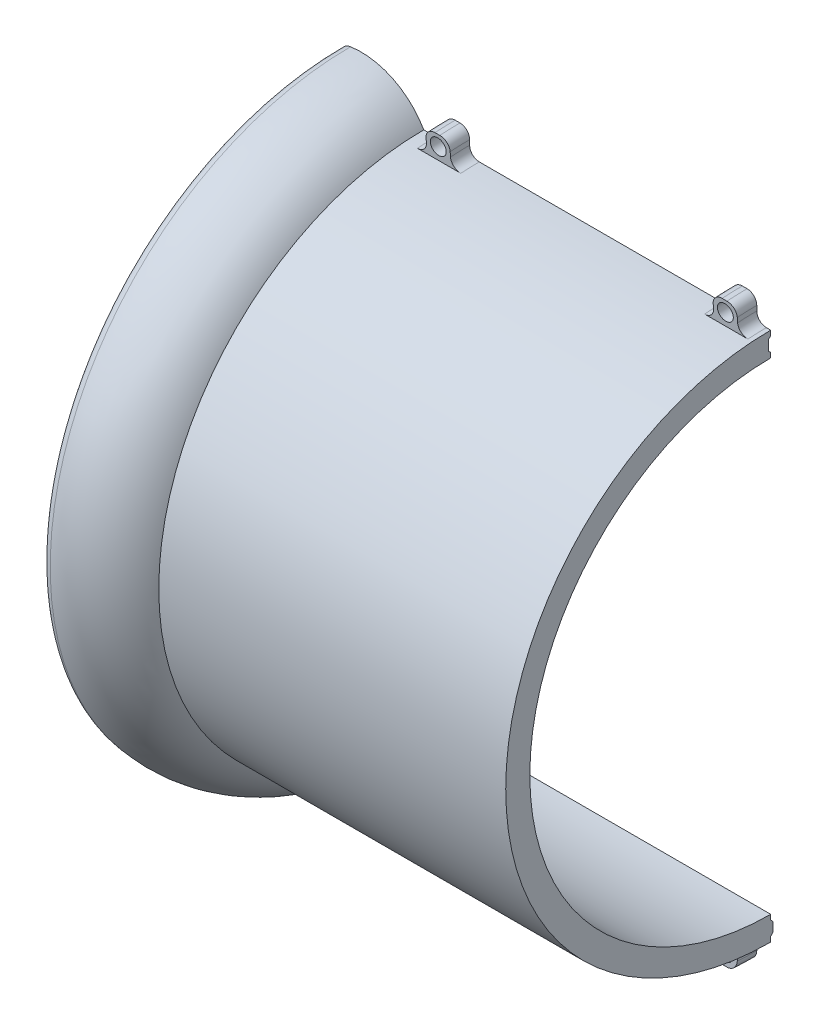
from build123d import *

# Parameters (mm, degrees)
REVOLVE1_ANGLE                 = 180
FILLET1_R                      = 2.5
FILLET2_R                      = 2.5
CUT_EXTRUDE1_DEPTH             = 70
BOSS_EXTRUDE1_DEPTH            = 70
SKETCH7_W                      = 5
SKETCH7_H                      = 5
REVOLVE2_ANGLE                 = 4
F_3_0MM_DOWEL_HOLE2_AT_2_COUNT = 2
F_3_0MM_DOWEL_HOLE2_AT_2_PITCH = 59.592915104
FILLET3_R                      = 2
FILLET3_OF_MIRROR3_R           = 2


with BuildPart() as part:
    # Sketch1 → Revolve1 (revolve)
    with BuildSketch(Plane.XY):
        with BuildLine():
            Line((4.330127019, 50), (0, 47.5))
            ThreePointArc((0, 47.5), (-4.264235636, 55.691520443), (-13.420201433, 56.896926208))
            Line((-13.420201433, 56.896926208), (-15.13030215, 61.595389312))
            ThreePointArc((-15.13030215, 61.595389312), (-4.86969785, 61.595389312), (2.990381057, 55))
            Line((2.990381057, 55), (75, 55))
            Line((75, 55), (75, 50))
            Line((75, 50), (4.330127019, 50))
        make_face()
    revolve(axis=Axis((-156.553254438, 0, 0), (1, 0, 0)), revolution_arc=REVOLVE1_ANGLE)

    # Fillet1
    fillet1_edges = [part.edges().sort_by_distance(p)[0] for p in [
        (4.330127019, 0, 50),
    ]]
    fillet(fillet1_edges, radius=FILLET1_R)

    # Fillet2
    fillet2_edges = [part.edges().sort_by_distance(p)[0] for p in [
        (-15.13030215, 0, 61.595389312),
        (-13.420201433, 0, 56.896926208),
    ]]
    fillet(fillet2_edges, radius=FILLET2_R - 0.0001)  # a hair under: the kernel refuses the full size

    # Sketch3 → Cut-Extrude1 (cut)
    with BuildSketch(Plane(origin=(75, 0, 0), x_dir=(0, 0, -1), z_dir=(1, 0, 0))):
        Polygon((0, 54), (0, 51), (-0.5, 51.5), (-0.5, 53.5), align=None)
    extrude(amount=-CUT_EXTRUDE1_DEPTH, mode=Mode.SUBTRACT)

    # Sketch5 → Boss-Extrude1 (add)
    with BuildSketch(Plane(origin=(75, 0, 0), x_dir=(0, 0, -1), z_dir=(1, 0, 0))):
        Polygon((0, -51.05), (0, -53.95), (0.5, -53.45), (0.5, -51.55), align=None)
    extrude(amount=-BOSS_EXTRUDE1_DEPTH)

    # Sketch7 → Revolve2 (revolve)
    with BuildSketch(Plane(origin=(0, 0, 0), x_dir=(-1, 0, 0), z_dir=(0, 0, -1))):
        with Locations((-69.608609025, 57.5)):
            Rectangle(SKETCH7_W, SKETCH7_H)
        with Locations((-10.015693921, 57.5)):
            Rectangle(SKETCH7_W, SKETCH7_H)
    revolve2 = revolve(axis=Axis((75, 0, 0), (1, 0, 0)), revolution_arc=REVOLVE2_ANGLE)

    # Sketch11 → Ø3.0mm Dowel Hole2 (revolve, cut)
    with BuildSketch(Plane(origin=(69.608609025, 57.5, 0), x_dir=(0, 1, 0), z_dir=(1, 0, 0))):
        Polygon((0, 0), (0, 45.991420021), (1.65, 45), (1.65, 0), align=None)
    f_3_0mm_dowel_hole2 = revolve(axis=Axis((69.608609025, 57.5, -6.35), (0, 0, 1)), mode=Mode.SUBTRACT)

    # Ø3.0mm Dowel Hole2 at 2: Ø3.0mm Dowel Hole2 ×2
    with Locations(*[(-i * F_3_0MM_DOWEL_HOLE2_AT_2_PITCH, 0, 0) for i in range(1, F_3_0MM_DOWEL_HOLE2_AT_2_COUNT)]):
        add(f_3_0mm_dowel_hole2, mode=Mode.SUBTRACT)

    # Fillet3
    fillet3_edges = [part.edges().sort_by_distance(p)[0] for p in [
        (72.108609025, 54.966495486, 1.919472319),
        (67.108609025, 54.966495486, 1.919472319),
        (67.108609025, 59.963449621, 2.093969802),
        (72.108609025, 59.963449621, 2.093969802),
        (7.515693921, 54.966495486, 1.919472319),
        (7.515693921, 59.963449621, 2.093969802),
        (12.515693921, 59.963449621, 2.093969802),
        (12.515693921, 54.966495486, 1.919472319),
    ]]
    fillet(fillet3_edges, radius=FILLET3_R)

    # Mirror3: Revolve2, Ø3.0mm Dowel Hole2 across plane
    add(revolve2.mirror(Plane.ZX))
    add(f_3_0mm_dowel_hole2.mirror(Plane.ZX), mode=Mode.SUBTRACT)

    # Mirror3 copy 1 sketch → Mirror3 copy 1 (revolve, cut)
    with BuildSketch(Plane(origin=(10.015693921, -57.5, 0), x_dir=(0, -1, 0), z_dir=(1, 0, 0))):
        Polygon((0, 0), (0, -45.991420021), (1.65, -45), (1.65, 0), align=None)
    revolve(axis=Axis((10.015693921, -57.5, -6.35), (0, 0, -1)), mode=Mode.SUBTRACT)

    # Fillet3 of Mirror3
    fillet3_of_mirror3_edges = [part.edges().sort_by_distance(p)[0] for p in [
        (72.108609025, -54.966495486, 1.919472319),
        (67.108609025, -54.966495486, 1.919472319),
        (67.108609025, -59.963449621, 2.093969802),
        (72.108609025, -59.963449621, 2.093969802),
        (7.515693921, -54.966495486, 1.919472319),
        (7.515693921, -59.963449621, 2.093969802),
        (12.515693921, -59.963449621, 2.093969802),
        (12.515693921, -54.966495486, 1.919472319),
    ]]
    fillet(fillet3_of_mirror3_edges, radius=FILLET3_OF_MIRROR3_R)


solid = part.part
